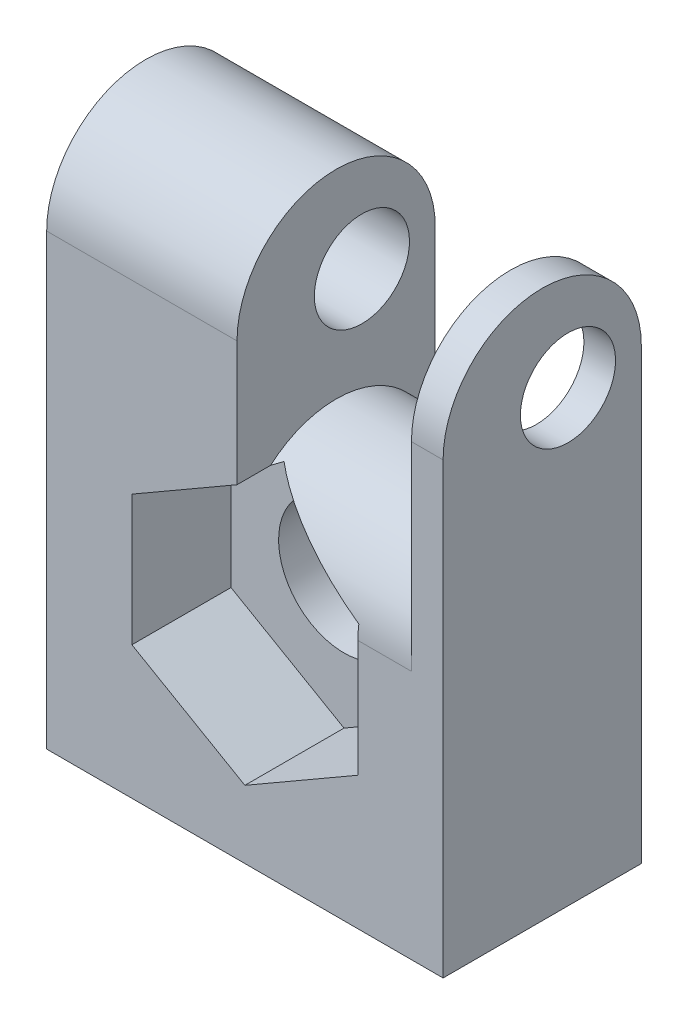
from build123d import *

# Parameters (mm, degrees)
SKETCH_1_R          = 1.65
EXTRUDE_1_DEPTH     = 2.5
SKETCH_1_3_W        = 10
SKETCH_1_3_H        = 10
EXTRUDE_2_DEPTH     = 5
EXTRUDE_3_DEPTH     = 10
OTHER_START         = -2.194885141
OTHER_1_DEPTH       = 4.4
OTHER_START_2       = -4.194885141
OTHER_1_2_OUTLINE_R = 1.2
OTHER_1_2_DEPTH     = 7.198493548
CUT_EXTRUDE_START   = -9.201507
CUT_EXTRUDE_1_DEPTH = 4.400001


# Read off the part's stored shape, not the designer's step: Отступ1
with BuildPart() as part:
    # Эскиз1 → Бобышка-Вытянуть1 (new body)
    with BuildSketch(Plane.XY):
        Polygon((-4.846391593, 58.406906995), (-4.846391593, 55.11601046), (-1.996391593, 53.470562193), (0.853608407, 55.11601046), (0.853608407, 58.406906995), (-1.996391593, 60.052355262), align=None)
        with Locations((-1.996391593, 56.761458727)):
            Circle(SKETCH_1_R, mode=Mode.SUBTRACT)
    extrude(amount=EXTRUDE_1_DEPTH)

    # Эскиз1<3> → Бобышка-Вытянуть2 (add)
    with BuildSketch(Plane.XY):
        with Locations((-1.996391593, 56.761458727)):
            Rectangle(SKETCH_1_3_W, SKETCH_1_3_H)
        Polygon((-4.846391593, 55.11601046), (-1.996391593, 53.470562193), (0.853608407, 55.11601046), (0.853608407, 58.406906995), (-1.996391593, 60.052355262), (-4.846391593, 58.406906995), align=None, mode=Mode.SUBTRACT)
    extrude(amount=EXTRUDE_2_DEPTH)

    # Эскиз2 → Бобышка-Вытянуть3 (add)
    with BuildSketch(Plane(origin=(3.003608407, 0, 0), x_dir=(0, 0, -1), z_dir=(1, 0, 0))):
        with BuildLine():
            Line((0, 63.079006264), (0, 61.761458727))
            Line((0, 61.761458727), (-5, 61.761458727))
            Line((-5, 61.761458727), (-5, 63.079006264))
            ThreePointArc((-5, 63.079006264), (-2.5, 65.579006264), (0, 63.079006264))
        make_face()
    extrude(amount=-EXTRUDE_3_DEPTH)

    # Отступ1 outline → Отступ1 (cut)
    with BuildSketch(Plane.YZ.offset(OTHER_START)):
        with BuildLine():
            Line((65.153996838, 3.894422503), (63.084523903, 3.899992575))
            ThreePointArc((63.084523903, 3.899992575), (61.080242494, 2.30545954), (62.195830177, 0))
            Line((62.195830177, 0), (63.079006264, 0))
            ThreePointArc((63.079006264, 0), (65.285367098, 1.324427003), (65.153996838, 3.894422503))
        make_face()
    extrude(amount=OTHER_1_DEPTH, mode=Mode.SUBTRACT)

    # Other 1 2 outline → Other 1 2 (cut)
    with BuildSketch(Plane.YZ.offset(OTHER_START_2)):
        with Locations((63.079006264, 1.85)):
            Circle(OTHER_1_2_OUTLINE_R)
    extrude(amount=OTHER_1_2_DEPTH, mode=Mode.SUBTRACT)

    # Эскиз3 → Вырез-Вытянуть1 (cut)
    with BuildSketch(Plane.ZY.offset(6.996391593).offset(CUT_EXTRUDE_START)):
        with BuildLine():
            ThreePointArc((0, 58.061458727), (2.5, 60.561458727), (5, 58.061458727))
            Line((5, 58.061458727), (5, 63.079006264))
            ThreePointArc((5, 63.079006264), (2.5, 65.579006264), (0, 63.079006264))
            Line((0, 63.079006264), (0, 58.061458727))
        make_face()
    extrude(amount=CUT_EXTRUDE_1_DEPTH, mode=Mode.SUBTRACT)


solid = part.part
